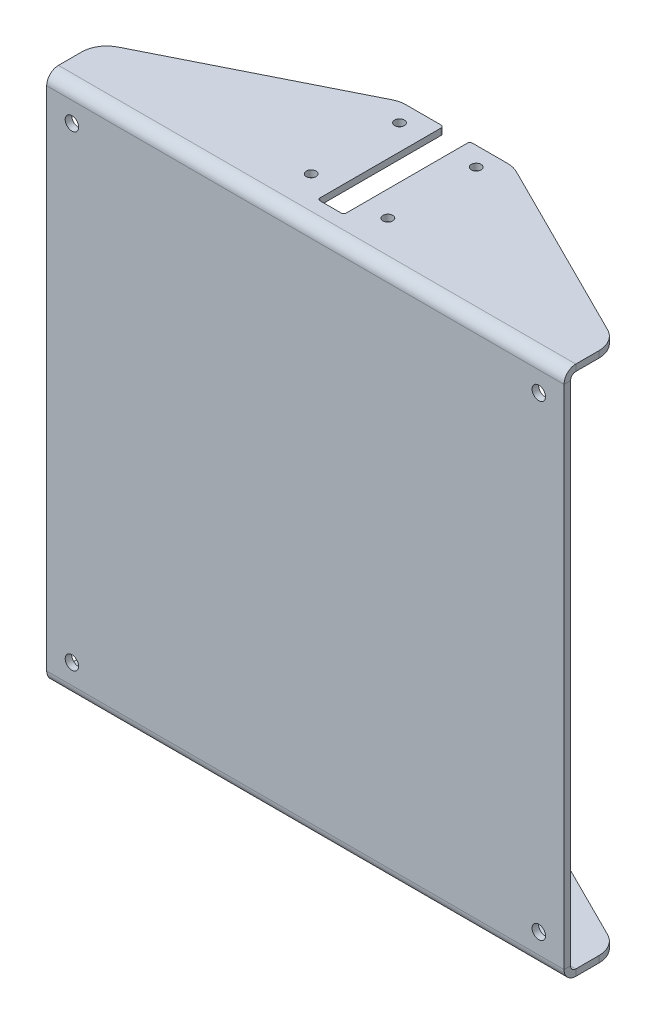
from build123d import *

# Parameters (mm, degrees)
SKETCH1_W                      = 260.35
SKETCH1_H                      = 260.35
BASE_FLANGE1_DEPTH             = 3.2639
EDGE_FLANGE1_STRIP_W           = 18.36928
EDGE_FLANGE1_STRIP_H           = 3.2639
EDGE_FLANGE1_STRIP_CUT_DEPTH   = 260.35
EDGE_FLANGE1_STRIP_2_W         = 18.36928
EDGE_FLANGE1_STRIP_2_H         = 3.2639
EDGE_FLANGE1_STRIP_CUT_2_DEPTH = 260.35
EDGE_FLANGE1_DEPTH             = 260.35
EDGE_FLANGE1_BEND_DEPTH        = 260.35
SKETCH16_W                     = 13.208
SKETCH16_H                     = 63.5
CUT_EXTRUDE1_DEPTH             = 307.55461301
CUT_EXTRUDE2_DEPTH             = 307.55461301
FILLET1_R                      = 12.7
F_10_0_1935_DIAMETER_HOLE1_D   = 4.9149
FILLET2_R                      = 1.27
F_1_4_CLEARANCE_HOLE1_D        = 6.7564


# Sheet-metal steps are written as plain solids
with BuildPart() as part:
    # Sketch1 → Base-Flange1 (new body)
    with BuildSketch(Plane.XY):
        Rectangle(SKETCH1_W, SKETCH1_H)
    extrude(amount=-BASE_FLANGE1_DEPTH)

    # Edge-Flange1 strip (across the edge) → Edge-Flange1 strip cut (cut)
    with BuildSketch(Plane(origin=(-130.175, 130.175, -3.2639), x_dir=(0, -1, 0), z_dir=(1, 0, 0))):
        with Locations((-6.5278, -1.63195)):
            Rectangle(EDGE_FLANGE1_STRIP_W, EDGE_FLANGE1_STRIP_H)
    extrude(amount=EDGE_FLANGE1_STRIP_CUT_DEPTH, mode=Mode.SUBTRACT)

    # Edge-Flange1 strip 2 (across the edge) → Edge-Flange1 strip cut 2 (cut)
    with BuildSketch(Plane(origin=(130.175, -130.175, -3.2639), x_dir=(0, 1, 0), z_dir=(-1, 0, 0))):
        with Locations((-6.5278, -1.63195)):
            Rectangle(EDGE_FLANGE1_STRIP_2_W, EDGE_FLANGE1_STRIP_2_H)
    extrude(amount=EDGE_FLANGE1_STRIP_CUT_2_DEPTH, mode=Mode.SUBTRACT)

    # Edge-Flange1 section (across the edge) → Edge-Flange1 (add)
    with BuildSketch(Plane(origin=(-130.175, 130.175, -3.2639), x_dir=(0, -1, 0), z_dir=(1, 0, 0))):
        with BuildLine():
            Line((-3.2639, 2.65684), (-3.2639, 72.9361))
            Line((-3.2639, 72.9361), (0, 72.9361))
            Line((0, 72.9361), (0, 2.65684))
            ThreePointArc((0, 2.65684), (0.778170419, 0.778170419), (2.65684, 0))
            Line((2.65684, 0), (2.65684, -3.2639))
            ThreePointArc((2.65684, -3.2639), (-1.529755404, -1.529755404), (-3.2639, 2.65684))
        make_face()
    extrude(amount=EDGE_FLANGE1_DEPTH)

    # Edge-Flange1 section 2 (across the edge) → Edge-Flange1 bend (add)
    with BuildSketch(Plane(origin=(130.175, -130.175, -3.2639), x_dir=(0, 1, 0), z_dir=(-1, 0, 0))):
        with BuildLine():
            Line((-3.2639, 2.65684), (-3.2639, 72.9361))
            Line((-3.2639, 72.9361), (0, 72.9361))
            Line((0, 72.9361), (0, 2.65684))
            ThreePointArc((0, 2.65684), (0.778170419, 0.778170419), (2.65684, 0))
            Line((2.65684, 0), (2.65684, -3.2639))
            ThreePointArc((2.65684, -3.2639), (-1.529755404, -1.529755404), (-3.2639, 2.65684))
        make_face()
    extrude(amount=EDGE_FLANGE1_BEND_DEPTH)

    # Sketch16 → Cut-Extrude1 (cut, through all)
    with BuildSketch(Plane(origin=(0, 133.4389, 0), x_dir=(1, 0, 0), z_dir=(0, 1, 0))):
        with Locations((0, 44.45)):
            Rectangle(SKETCH16_W, SKETCH16_H)
    extrude(amount=-CUT_EXTRUDE1_DEPTH, mode=Mode.SUBTRACT)

    # Sketch18 → Cut-Extrude2 (cut, through all)
    with BuildSketch(Plane(origin=(0, 133.4389, 0), x_dir=(1, 0, 0), z_dir=(0, 1, 0))):
        Polygon((-130.175, 76.2), (-130.175, 25.4), (-28.575, 76.2), align=None)
        Polygon((130.175, 76.2), (28.575, 76.2), (130.175, 25.4), align=None)
    extrude(amount=-CUT_EXTRUDE2_DEPTH, mode=Mode.SUBTRACT)

    # Fillet1
    fillet1_edges = [part.edges().sort_by_distance(p)[0] for p in [
        (-28.575, 131.80695, -76.2),
        (-130.175, 131.80695, -25.4),
        (-28.575, -131.80695, -76.2),
        (-130.175, -131.80695, -25.4),
        (28.575, 131.80695, -76.2),
        (130.175, 131.80695, -25.4),
        (130.175, -131.80695, -25.4),
        (28.575, -131.80695, -76.2),
    ]]
    fillet(fillet1_edges, radius=FILLET1_R)

    # #10 (0.1935) Diameter Hole1 (through all)
    with Locations(Plane(origin=(0, 133.4389, 0), x_dir=(1, 0, 0), z_dir=(0, 1, 0))):
        with Locations((-19.304, 22.225), (-19.304, 66.675), (19.304, 66.675), (19.304, 22.225)):
            Hole(F_10_0_1935_DIAMETER_HOLE1_D / 2)

    # Fillet2
    fillet2_edges = [part.edges().sort_by_distance(p)[0] for p in [
        (-6.604, 131.80695, -76.2),
        (6.604, 131.80695, -12.7),
        (-6.604, 131.80695, -12.7),
        (6.604, 131.80695, -76.2),
        (-6.604, -131.80695, -12.7),
        (-6.604, -131.80695, -76.2),
        (6.604, -131.80695, -76.2),
        (6.604, -131.80695, -12.7),
    ]]
    fillet(fillet2_edges, radius=FILLET2_R)

    # 1/4 Clearance Hole1 (through all)
    with Locations(Plane.XY):
        with Locations((117.475, 117.475), (-117.475, -117.475), (-117.475, 117.475), (117.475, -117.475)):
            Hole(F_1_4_CLEARANCE_HOLE1_D / 2)


solid = part.part
